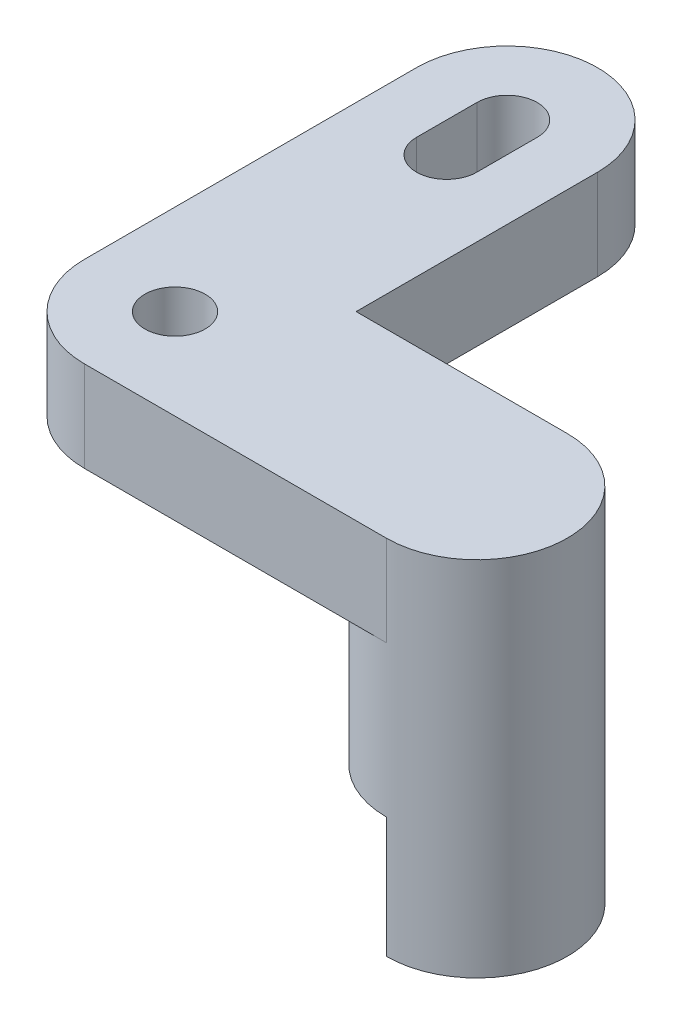
from build123d import *
from build123d.topology import SkipClean

# Parameters (mm, degrees)
SKETCH1_R           = 0.5
BOSS_EXTRUDE1_DEPTH = 1.5
SKETCH2_R           = 1.5
BOSS_EXTRUDE2_DEPTH = 12
SKETCH3_R           = 0.5
BOSS_EXTRUDE3_DEPTH = 1.5
SKETCH4_W           = 12.359530896
SKETCH4_H           = 10.726112716
CUT_EXTRUDE1_DEPTH  = 9
CUT_EXTRUDE3_DEPTH  = 2


with BuildPart() as part:
    # Sketch1 → Boss-Extrude1 (new body)
    with BuildSketch(Plane(origin=(0, 0, 0), x_dir=(1, 0, 0), z_dir=(0, 1, 0))):
        with BuildLine():
            Line((5, -1), (1.5, -1))
            Line((1.5, -1), (1.5, 2.5))
            Line((1.5, 2.5), (1.5, 3))
            ThreePointArc((1.5, 3), (0, 4.5), (-1.5, 3))
            Line((-1.5, 3), (-1.5, 2.5))
            Line((-1.5, 2.5), (-1.5, -2.5))
            ThreePointArc((-1.5, -2.5), (-1.060660172, -3.560660172), (0, -4))
            Line((0, -4), (5, -4))
            ThreePointArc((5, -4), (6.5, -2.5), (5, -1))
        make_face()
        with Locations((0, -2.5)):
            Circle(SKETCH1_R, mode=Mode.SUBTRACT)
        with BuildLine():
            Line((-0.5, 3), (-0.5, 2))
            ThreePointArc((-0.5, 2), (0, 1.5), (0.5, 2))
            Line((0.5, 2), (0.5, 3))
            ThreePointArc((0.5, 3), (0, 3.5), (-0.5, 3))
        make_face(mode=Mode.SUBTRACT)
    extrude(amount=BOSS_EXTRUDE1_DEPTH)

    # Sketch2 → Boss-Extrude2 (add)
    with BuildSketch(Plane(origin=(0, 1.5, 0), x_dir=(1, 0, 0), z_dir=(0, 1, 0))):
        with Locations((5, -2.5)):
            Circle(SKETCH2_R)
    extrude(amount=BOSS_EXTRUDE2_DEPTH)

    # Sketch3 → Boss-Extrude3 (add)
    with SkipClean():  # the faces are left unmerged after this step: merging them gives an invalid solid
        with BuildSketch(Plane(origin=(0, 13.5, 0), x_dir=(1, 0, 0), z_dir=(0, 1, 0))):
            with BuildLine():
                Line((1.5, -1), (5, -1))
                ThreePointArc((5, -1), (6.5, -2.5), (5, -4))
                Line((5, -4), (0, -4))
                ThreePointArc((0, -4), (-1.060660172, -3.560660172), (-1.5, -2.5))
                Line((-1.5, -2.5), (-1.5, 2.5))
                Line((-1.5, 2.5), (-1.5, 3))
                ThreePointArc((-1.5, 3), (0, 4.5), (1.5, 3))
                Line((1.5, 3), (1.5, 2.5))
                Line((1.5, 2.5), (1.5, -1))
            make_face()
            with Locations((0, -2.5)):
                Circle(SKETCH3_R, mode=Mode.SUBTRACT)
            with BuildLine():
                Line((-0.5, 3), (-0.5, 2))
                ThreePointArc((-0.5, 2), (0, 1.5), (0.5, 2))
                Line((0.5, 2), (0.5, 3))
                ThreePointArc((0.5, 3), (0, 3.5), (-0.5, 3))
            make_face(mode=Mode.SUBTRACT)
        extrude(amount=BOSS_EXTRUDE3_DEPTH)

    # Sketch4 → Cut-Extrude1 (cut)
    with SkipClean():  # the faces are left unmerged after this step: merging them gives an invalid solid
        with BuildSketch(Plane.XZ):
            with Locations((1.656067274, 0.008624545)):
                Rectangle(SKETCH4_W, SKETCH4_H)
        extrude(amount=-CUT_EXTRUDE1_DEPTH, mode=Mode.SUBTRACT)
    add(part.part.scale(1), mode=Mode.REPLACE)  # the faces are merged on a copy

    # Sketch5 → Cut-Extrude3 (cut)
    with BuildSketch(Plane.XZ.offset(-9)):
        with BuildLine():
            Line((5, 4), (5, 1))
            ThreePointArc((5, 1), (3.5, 2.5), (5, 4))
        make_face()
    extrude(amount=-CUT_EXTRUDE3_DEPTH, mode=Mode.SUBTRACT)


solid = part.part
